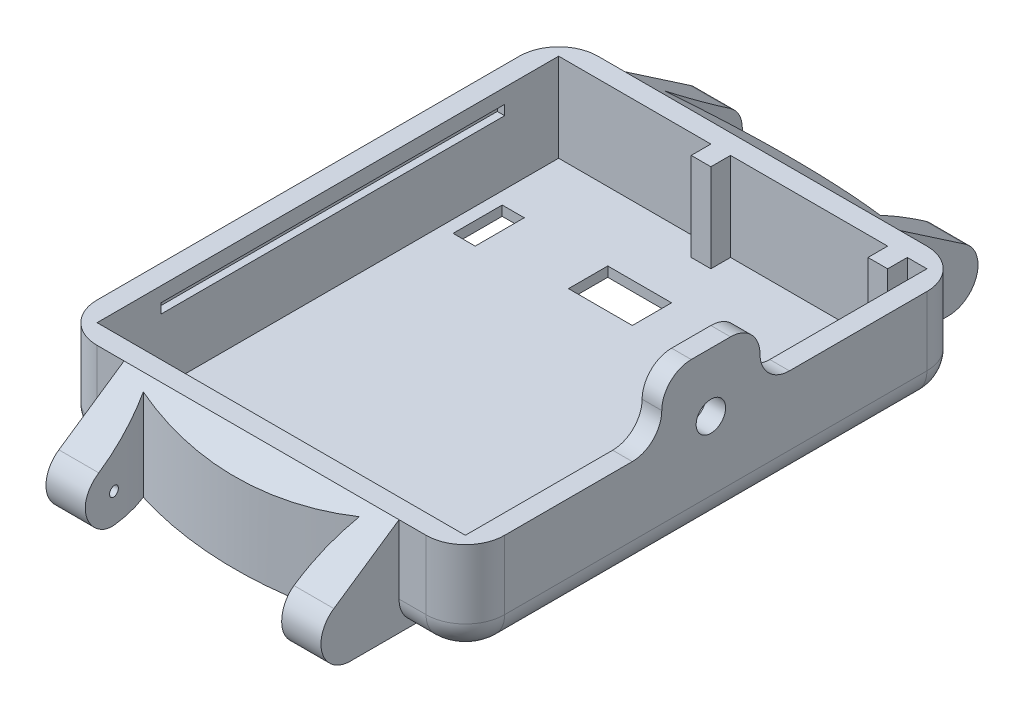
from build123d import *

# Parameters (mm, degrees)
SKETCH1_W            = 41.5
SKETCH1_H            = 51
SKETCH1_W_2          = 37.5
SKETCH1_H_2          = 47
BOSS_EXTRUDE1_DEPTH  = 8
SKETCH2_W            = 41.5
SKETCH2_H            = 51
BOSS_EXTRUDE2_DEPTH  = 2
FILLET1_R            = 4
FILLET2_R            = 3
SKETCH3_W            = 5.5
SKETCH3_H            = 20
BOSS_EXTRUDE3_DEPTH  = 6
SKETCH4_R            = 1.4
BOSS_EXTRUDE4_DEPTH  = 3.5
FILLET3_R            = 0.5
SKETCH5_W            = 6.5
SKETCH5_H            = 4
CUT_EXTRUDE1_DEPTH   = 34.835077952
SKETCH6_W            = 2
SKETCH6_H            = 10
BOSS_EXTRUDE6_DEPTH  = 6
FILLET4_R            = 3
SKETCH7_R            = 1.5
CUT_EXTRUDE2_DEPTH   = 2
SKETCH8_W            = 35
SKETCH8_H            = 1
CUT_EXTRUDE3_DEPTH   = 0.75
SKETCH9_W            = 9
SKETCH9_H            = 1
SKETCH9_W_2          = 8.5
CUT_EXTRUDE4_DEPTH   = 0.75
BOSS_EXTRUDE7_DEPTH  = 14
FILLET6_R            = 3
CUT_EXTRUDE5_DEPTH   = 42.779440692
MIRROR1_START        = 10.997748531
MIRROR1_DEPTH        = 3.002251469
MIRROR1_START_2      = -14
MIRROR1_2_DEPTH      = 2.9999999
MIRROR1_START_3      = -11.0000001
MIRROR1_3_DEPTH      = 21.997748631
MIRROR1_START_4      = -3
MIRROR1_4_DEPTH      = 10.290302021
SKETCH13_R           = 0.5
CUT_EXTRUDE6_DEPTH   = 11.5
CUT_EXTRUDE7_DEPTH   = 6
SKETCH15_W           = 4.2
SKETCH15_H           = 10.25
CUT_EXTRUDE8_DEPTH   = 42.779440772
SKETCH16_R           = 1.75
SKETCH16_R_2         = 0.5
BOSS_EXTRUDE8_DEPTH  = 3
CUT_EXTRUDE9_START   = -1
SKETCH17_W           = 37.5
SKETCH17_H           = 47
SKETCH17_R           = 1.75
SKETCH17_R_2         = 1.4
SKETCH17_W_2         = 4.2
SKETCH17_H_2         = 10.25
SKETCH17_W_3         = 6.5
SKETCH17_H_3         = 4
CUT_EXTRUDE9_DEPTH   = 1
CUT_EXTRUDE10_START  = -4.5
SKETCH18_R           = 1.4
CUT_EXTRUDE10_DEPTH  = 4.5
SKETCH19_W           = 4.2
SKETCH19_H           = 10.25
BOSS_EXTRUDE9_DEPTH  = 1
CUT_EXTRUDE11_START  = -4
SKETCH20_R           = 1.75
CUT_EXTRUDE11_DEPTH  = 4
SKETCH23_W           = 2.25
SKETCH23_H           = 5
CUT_EXTRUDE12_DEPTH  = 43.125071765
SKETCH26_W           = 2
SKETCH26_H           = 2
BOSS_EXTRUDE10_DEPTH = 9


with BuildPart() as part:
    # Sketch1 → Boss-Extrude1 (new body)
    with BuildSketch(Plane(origin=(0, 0, 0), x_dir=(1, 0, 0), z_dir=(0, 1, 0))):
        Rectangle(SKETCH1_W, SKETCH1_H)
        Rectangle(SKETCH1_W_2, SKETCH1_H_2, mode=Mode.SUBTRACT)
    extrude(amount=BOSS_EXTRUDE1_DEPTH)

    # Sketch2 → Boss-Extrude2 (add)
    with BuildSketch(Plane.XZ):
        Rectangle(SKETCH2_W, SKETCH2_H)
    extrude(amount=BOSS_EXTRUDE2_DEPTH)

    # Fillet1
    fillet1_edges = [part.edges().sort_by_distance(p)[0] for p in [
        (20.75, 3, -25.5),
        (20.75, 3, 25.5),
        (-20.75, 3, 25.5),
        (-20.75, 3, -25.5),
    ]]
    fillet(fillet1_edges, radius=FILLET1_R)

    # Fillet2
    fillet2_edges = [part.edges().sort_by_distance(p)[0] for p in [
        (-20.75, -2, 0),
        (0, -2, -25.5),
        (20.75, -2, 0),
        (0, -2, 25.5),
        (19.578427125, -2, -24.328427125),
        (19.578427125, -2, 24.328427125),
        (-19.578427125, -2, 24.328427125),
        (-19.578427125, -2, -24.328427125),
    ]]
    fillet(fillet2_edges, radius=FILLET2_R)

    # Sketch3 → Boss-Extrude3 (add)
    with BuildSketch(Plane(origin=(0, 0, 0), x_dir=(1, 0, 0), z_dir=(0, 1, 0))):
        with Locations((16, 13.5)):
            Rectangle(SKETCH3_W, SKETCH3_H)
    extrude(amount=BOSS_EXTRUDE3_DEPTH)

    # Sketch4 → Boss-Extrude4 (add)
    with BuildSketch(Plane(origin=(0, 0, 0), x_dir=(1, 0, 0), z_dir=(0, 1, 0))):
        with Locations(Location((0.245140852, 21.1, 0), (0, 0, 90))):
            Circle(SKETCH4_R)
        with Locations(Location((0.245140852, 6.1, 0), (0, 0, 90))):
            Circle(SKETCH4_R)
    extrude(amount=BOSS_EXTRUDE4_DEPTH)

    # Fillet3
    fillet3_edges = [part.edges().sort_by_distance(p)[0] for p in [
        (0.245140852, 3.5, -19.7),
        (0.245140852, 3.5, -4.7),
    ]]
    fillet(fillet3_edges, radius=FILLET3_R)

    # Sketch5 → Cut-Extrude1 (cut, through all)
    with BuildSketch(Plane(origin=(0, 0, 0), x_dir=(1, 0, 0), z_dir=(0, 1, 0))):
        with Locations((-3.5, 14.5)):
            Rectangle(SKETCH5_W, SKETCH5_H)
    extrude(amount=-CUT_EXTRUDE1_DEPTH, mode=Mode.SUBTRACT)

    # Sketch6 → Boss-Extrude6 (add)
    with BuildSketch(Plane(origin=(0, 8, 0), x_dir=(1, 0, 0), z_dir=(0, 1, 0))):
        with Locations((19.75, -0.5)):
            Rectangle(SKETCH6_W, SKETCH6_H)
    extrude(amount=BOSS_EXTRUDE6_DEPTH)

    # Fillet4
    fillet4_edges = [part.edges().sort_by_distance(p)[0] for p in [
        (19.75, 8, -4.5),
    ]]
    fillet(fillet4_edges, radius=FILLET4_R)
    fillet4_2_edges = [part.edges().sort_by_distance(p)[0] for p in [
        (19.75, 8, 5.5),
    ]]
    fillet(fillet4_2_edges, radius=FILLET4_R)
    fillet4_3_edges = [part.edges().sort_by_distance(p)[0] for p in [
        (19.75, 14, -4.5),
    ]]
    fillet(fillet4_3_edges, radius=FILLET4_R - 0.0001)  # a hair under: the kernel refuses the full size
    fillet4_4_edges = [part.edges().sort_by_distance(p)[0] for p in [
        (19.75, 14, 5.5),
    ]]
    fillet(fillet4_4_edges, radius=FILLET4_R - 0.0001)  # a hair under: the kernel refuses the full size

    # Sketch7 → Cut-Extrude2 (cut)
    with BuildSketch(Plane(origin=(20.75, 0, 0), x_dir=(0, 0, -1), z_dir=(1, 0, 0))):
        with Locations((-0.5, 8)):
            Circle(SKETCH7_R)
    extrude(amount=-CUT_EXTRUDE2_DEPTH, mode=Mode.SUBTRACT)

    # Sketch8 → Cut-Extrude3 (cut)
    with BuildSketch(Plane(origin=(-18.75, 0, 0), x_dir=(0, 0, -1), z_dir=(1, 0, 0))):
        with Locations((0.5, 6)):
            Rectangle(SKETCH8_W, SKETCH8_H)
    extrude(amount=-CUT_EXTRUDE3_DEPTH, mode=Mode.SUBTRACT)

    # Sketch9 → Cut-Extrude4 (cut)
    with BuildSketch(Plane.ZY.offset(-18.75)):
        with Locations((-11.5, 6)):
            Rectangle(SKETCH9_W, SKETCH9_H)
        with Locations((12.75, 6)):
            Rectangle(SKETCH9_W_2, SKETCH9_H)
    extrude(amount=-CUT_EXTRUDE4_DEPTH, mode=Mode.SUBTRACT)

    # Sketch10 → Boss-Extrude7 (add, symmetric)
    with BuildSketch(Plane(origin=(0, 0, 0), x_dir=(0, 0, -1), z_dir=(1, 0, 0))):
        with BuildLine():
            Line((-40.187882415, -2), (-25.5, 8))
            Line((-25.5, 8), (-25.5, 1))
            ThreePointArc((-25.5, 1), (-24.621320344, -1.121320344), (-22.5, -2))
            Line((-22.5, -2), (-40.187882415, -2))
        make_face()
    extrude(amount=BOSS_EXTRUDE7_DEPTH, both=True)

    # Fillet6
    fillet6_edges = [part.edges().sort_by_distance(p)[0] for p in [
        (0, -2, 40.187882415),
    ]]
    fillet(fillet6_edges, radius=FILLET6_R)

    # Sketch12 → Cut-Extrude5 (cut, symmetric)
    with BuildSketch(Plane(origin=(0, 0, 0), x_dir=(1, 0, 0), z_dir=(0, 1, 0))):
        with BuildLine():
            ThreePointArc((-10, -33.450846993), (-10.0925407, -29.937641684), (-11, -26.542396046))
            ThreePointArc((-11, -26.542396046), (-0.001557097, -28.220686258), (10.997748531, -26.548059567))
            ThreePointArc((10.997748531, -26.548059567), (10.092104456, -29.940657614), (10, -33.450846993))
            ThreePointArc((10, -33.450846993), (0, -35.763467262), (-10, -33.450846993))
        make_face()
    extrude(amount=CUT_EXTRUDE5_DEPTH, both=True, mode=Mode.SUBTRACT)

    # Mirror1: read off the stored shape, not the designer's step
    # Mirror1 outline → Mirror1 (add)
    with BuildSketch(Plane.YZ.offset(MIRROR1_START)):
        with BuildLine():
            ThreePointArc((1, -25.5), (-1.121320344, -24.621320344), (-2, -22.5))
            Line((-2, -22.5), (-2, -30.450846993))
            ThreePointArc((-2, -30.450846993), (0.116669534, -33.31785367), (3.479818192, -32.139189888))
            Line((3.479818192, -32.139189888), (8, -25.5))
            Line((8, -25.5), (1, -25.5))
        make_face()
    extrude(amount=MIRROR1_DEPTH)

    # Mirror1 2 outline → Mirror1 2 (add)
    with BuildSketch(Plane.YZ.offset(MIRROR1_START_2)):
        with BuildLine():
            ThreePointArc((1, -25.5), (-1.121320344, -24.621320344), (-2, -22.5))
            Line((-2, -22.5), (-2, -30.450846993))
            ThreePointArc((-2, -30.450846993), (0.116669534, -33.31785367), (3.479818192, -32.139189888))
            Line((3.479818192, -32.139189888), (8, -25.5))
            Line((8, -25.5), (1, -25.5))
        make_face()
    extrude(amount=MIRROR1_2_DEPTH)

    # Mirror1 3 outline → Mirror1 3 (add)
    with BuildSketch(Plane.YZ.offset(MIRROR1_START_3)):
        with BuildLine():
            ThreePointArc((1.000000002, -25.5), (-1.121320344, -24.621320344), (-2, -22.499999998))
            Line((-2, -22.499999998), (-2, -30.450846993))
            ThreePointArc((-2, -30.450846993), (0.116669534, -33.31785367), (3.479818192, -32.139189888))
            Line((3.479818192, -32.139189888), (8, -25.5))
            Line((8, -25.5), (1.000000002, -25.5))
        make_face()
    extrude(amount=MIRROR1_3_DEPTH)

    # Mirror1 4 outline → Mirror1 4 (cut)
    with BuildSketch(Plane(origin=(0, 0, 0), x_dir=(1, 0, 0), z_dir=(0, 1, 0)).offset(MIRROR1_START_4)):
        with BuildLine():
            ThreePointArc((-11, 26.542396046), (-0.001557097, 28.220686258), (10.997748531, 26.548059567))
            ThreePointArc((10.997748531, 26.548059567), (10.092086007, 29.940785259), (10.000023464, 33.451103865))
            Line((10.000023464, 33.451103865), (10.141518844, 35))
            Line((10.141518844, 35), (-10.141519787, 35))
            Line((-10.141519787, 35), (-10.000024287, 33.451112878))
            ThreePointArc((-10.000024287, 33.451112878), (-10.092521576, 29.937773803), (-11, 26.542396046))
        make_face()
    extrude(amount=MIRROR1_4_DEPTH, mode=Mode.SUBTRACT)

    # Sketch13 → Cut-Extrude6 (cut, symmetric)
    with BuildSketch(Plane(origin=(0, 0, 0), x_dir=(0, 0, -1), z_dir=(1, 0, 0))):
        with Locations(Location((-30.5, 1, 0), (0, 0, 180))):
            Circle(SKETCH13_R)
    cut_extrude6 = extrude(amount=CUT_EXTRUDE6_DEPTH, both=True, mode=Mode.SUBTRACT)

    # Mirror2: Cut-Extrude6 across plane
    add(cut_extrude6.mirror(Plane.XY), mode=Mode.SUBTRACT)

    # Sketch14 → Cut-Extrude7 (cut)
    with BuildSketch(Plane(origin=(0, 6, 0), x_dir=(1, 0, 0), z_dir=(0, 1, 0))):
        Polygon((18.75, 23.5), (13.25, 23.5), (13.25, 3.5), (18.75, 3.5), (18.75, 7), (18.75, 16), align=None)
    extrude(amount=-CUT_EXTRUDE7_DEPTH, mode=Mode.SUBTRACT)

    # Sketch15 → Cut-Extrude8 (cut, through all)
    with BuildSketch(Plane(origin=(0, 0, 0), x_dir=(1, 0, 0), z_dir=(0, 1, 0))):
        with Locations((14.15, 13.375)):
            Rectangle(SKETCH15_W, SKETCH15_H)
    extrude(amount=-CUT_EXTRUDE8_DEPTH, mode=Mode.SUBTRACT)

    # Sketch16 → Boss-Extrude8 (add)
    with BuildSketch(Plane(origin=(0, 0, 0), x_dir=(1, 0, 0), z_dir=(0, 1, 0))):
        with Locations(Location((-16.25, 19.5, 0), (0, 0, 90))):
            Circle(SKETCH16_R)
        with Locations(Location((-16.25, 19.5, 0), (0, 0, 270))):
            Circle(SKETCH16_R_2, mode=Mode.SUBTRACT)
    extrude(amount=BOSS_EXTRUDE8_DEPTH)

    # Sketch17 → Cut-Extrude9 (cut)
    with BuildSketch(Plane(origin=(0, 0, 0), x_dir=(1, 0, 0), z_dir=(0, 1, 0)).offset(CUT_EXTRUDE9_START)):
        Rectangle(SKETCH17_W, SKETCH17_H)
        with Locations(Location((-16.25, 19.5, 0), (0, 0, 270))):
            Circle(SKETCH17_R, mode=Mode.SUBTRACT)
        with Locations(Location((0.245140852, 21.1, 0), (0, 0, 270))):
            Circle(SKETCH17_R_2, mode=Mode.SUBTRACT)
        with Locations(Location((0.245140852, 6.1, 0), (0, 0, 270))):
            Circle(SKETCH17_R_2, mode=Mode.SUBTRACT)
        with Locations((14.15, 13.375)):
            Rectangle(SKETCH17_W_2, SKETCH17_H_2, mode=Mode.SUBTRACT)
        with Locations((-3.5, 14.5)):
            Rectangle(SKETCH17_W_3, SKETCH17_H_3, mode=Mode.SUBTRACT)
    extrude(amount=CUT_EXTRUDE9_DEPTH, mode=Mode.SUBTRACT)

    # Sketch18 → Cut-Extrude10 (cut)
    with BuildSketch(Plane(origin=(0, 3.5, 0), x_dir=(1, 0, 0), z_dir=(0, 1, 0)).offset(CUT_EXTRUDE10_START)):
        with Locations((0.245140852, 21.1)):
            Circle(SKETCH18_R)
        with Locations((0.245140852, 6.1)):
            Circle(SKETCH18_R)
    extrude(amount=CUT_EXTRUDE10_DEPTH, mode=Mode.SUBTRACT)

    # Sketch19 → Boss-Extrude9 (add)
    with BuildSketch(Plane.XZ.offset(2)):
        with Locations((14.15, -13.375)):
            Rectangle(SKETCH19_W, SKETCH19_H)
    extrude(amount=-BOSS_EXTRUDE9_DEPTH)

    # Sketch20 → Cut-Extrude11 (cut)
    with BuildSketch(Plane(origin=(0, 3, 0), x_dir=(1, 0, 0), z_dir=(0, 1, 0)).offset(CUT_EXTRUDE11_START)):
        with Locations((-16.25, 19.5)):
            Circle(SKETCH20_R)
    extrude(amount=CUT_EXTRUDE11_DEPTH, mode=Mode.SUBTRACT)

    # Sketch23 → Cut-Extrude12 (cut, through all)
    with BuildSketch(Plane(origin=(0, -1, 0), x_dir=(1, 0, 0), z_dir=(0, 1, 0))):
        with Locations((-16.375, 14)):
            Rectangle(SKETCH23_W, SKETCH23_H)
    extrude(amount=-CUT_EXTRUDE12_DEPTH, mode=Mode.SUBTRACT)

    # Sketch26 → Boss-Extrude10 (add)
    with BuildSketch(Plane(origin=(0, -1, 0), x_dir=(1, 0, 0), z_dir=(0, 1, 0))):
        with Locations((-2.25, 22.5)):
            Rectangle(SKETCH26_W, SKETCH26_H)
        with Locations((15.75, 22.5)):
            Rectangle(SKETCH26_W, SKETCH26_H)
    extrude(amount=BOSS_EXTRUDE10_DEPTH)


solid = part.part
